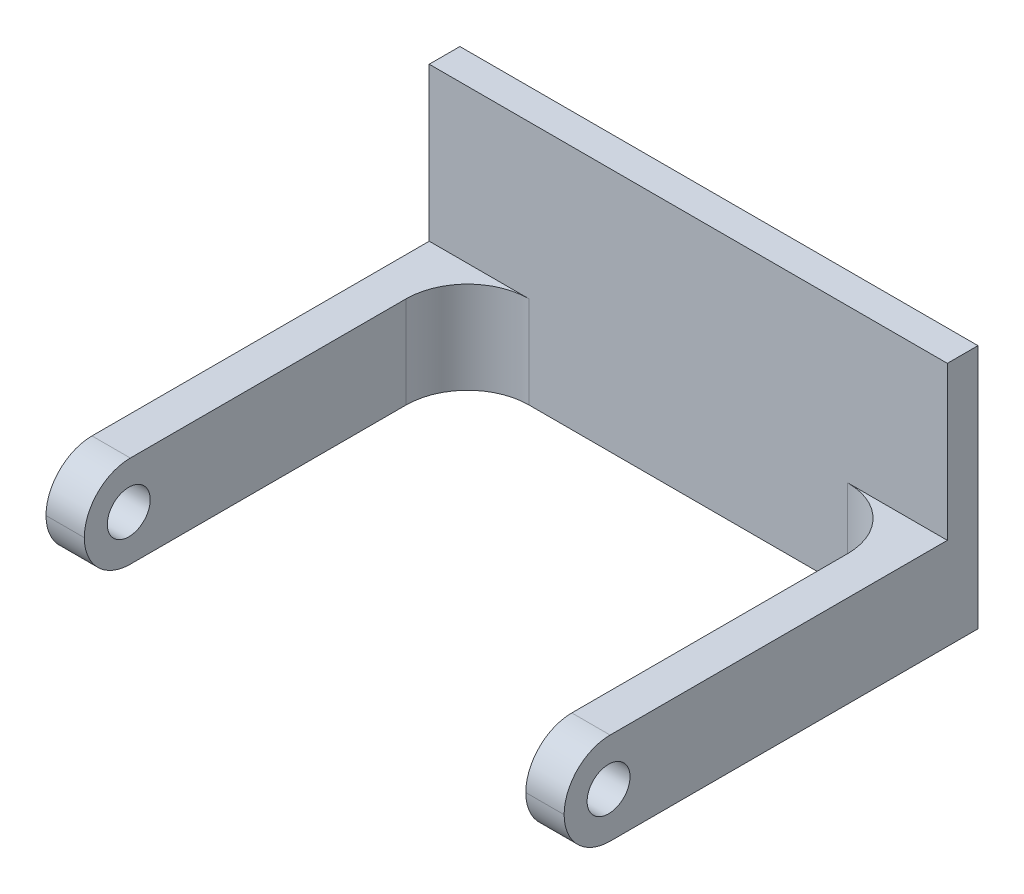
from build123d import *

# Parameters (mm, degrees)
SKETCH1_W           = 33.8
SKETCH1_H           = 6
BOSS_EXTRUDE1_DEPTH = 2
SKETCH2_W           = 2.5
SKETCH2_H           = 6
BOSS_EXTRUDE2_DEPTH = 25
SKETCH3_R           = 1.4
CUT_EXTRUDE1_DEPTH  = 44.364040402
FILLET1_R           = 3
SKETCH4_W           = 33.8
SKETCH4_H           = 2
BOSS_EXTRUDE3_DEPTH = 10
FILLET2_R           = 4


with BuildPart() as part:
    # Sketch1 → Boss-Extrude1 (new body)
    with BuildSketch(Plane.XY):
        Rectangle(SKETCH1_W, SKETCH1_H)
    extrude(amount=BOSS_EXTRUDE1_DEPTH)

    # Sketch2 → Boss-Extrude2 (add)
    with BuildSketch(Plane.XY.offset(2)):
        with Locations((-15.65, 0)):
            Rectangle(SKETCH2_W, SKETCH2_H)
        with Locations((15.65, 0)):
            Rectangle(SKETCH2_W, SKETCH2_H)
    extrude(amount=BOSS_EXTRUDE2_DEPTH)

    # Sketch3 → Cut-Extrude1 (cut, through all)
    with BuildSketch(Plane(origin=(16.9, 0, 0), x_dir=(0, 0, -1), z_dir=(1, 0, 0))):
        with Locations((-24.1, 0)):
            Circle(SKETCH3_R)
    extrude(amount=-CUT_EXTRUDE1_DEPTH, mode=Mode.SUBTRACT)

    # Fillet1
    fillet1_edges = [part.edges().sort_by_distance(p)[0] for p in [
        (-15.65, -3, 27),
        (15.65, -3, 27),
        (-15.65, 3, 27),
        (15.65, 3, 27),
    ]]
    fillet(fillet1_edges, radius=FILLET1_R - 0.0001)  # a hair under: the kernel refuses the full size

    # Sketch4 → Boss-Extrude3 (add)
    with BuildSketch(Plane(origin=(0, 3, 0), x_dir=(1, 0, 0), z_dir=(0, 1, 0))):
        with Locations((0, -1)):
            Rectangle(SKETCH4_W, SKETCH4_H)
    extrude(amount=BOSS_EXTRUDE3_DEPTH)

    # Fillet2
    fillet2_edges = [part.edges().sort_by_distance(p)[0] for p in [
        (14.4, 0, 2),
        (-14.4, 0, 2),
    ]]
    fillet(fillet2_edges, radius=FILLET2_R)


solid = part.part
